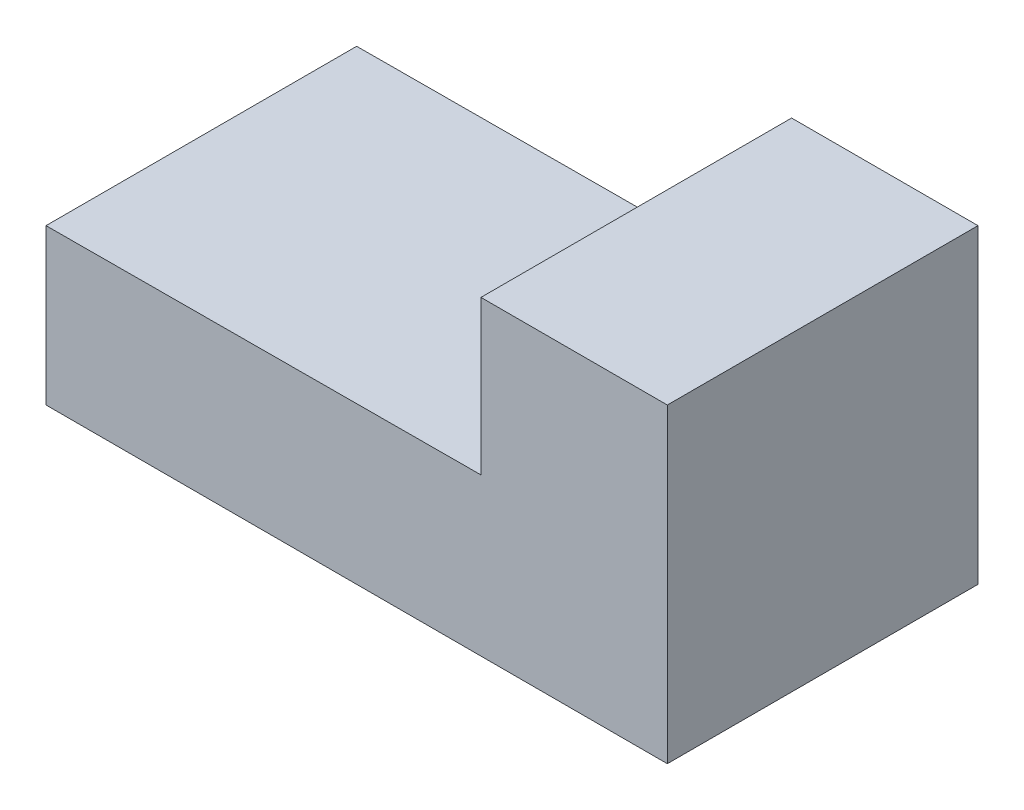
from build123d import *

# Parameters (mm, degrees)
RESSALTO_EXTRUS_O1_DEPTH = 30


with BuildPart() as part:
    # Esboço1 → Ressalto-extrusão1 (new body)
    with BuildSketch(Plane.XY):
        Polygon((0, 0), (0, -15), (60, -15), (60, 15), (42, 15), (42, 0.15625), align=None)
    extrude(amount=RESSALTO_EXTRUS_O1_DEPTH)


solid = part.part
